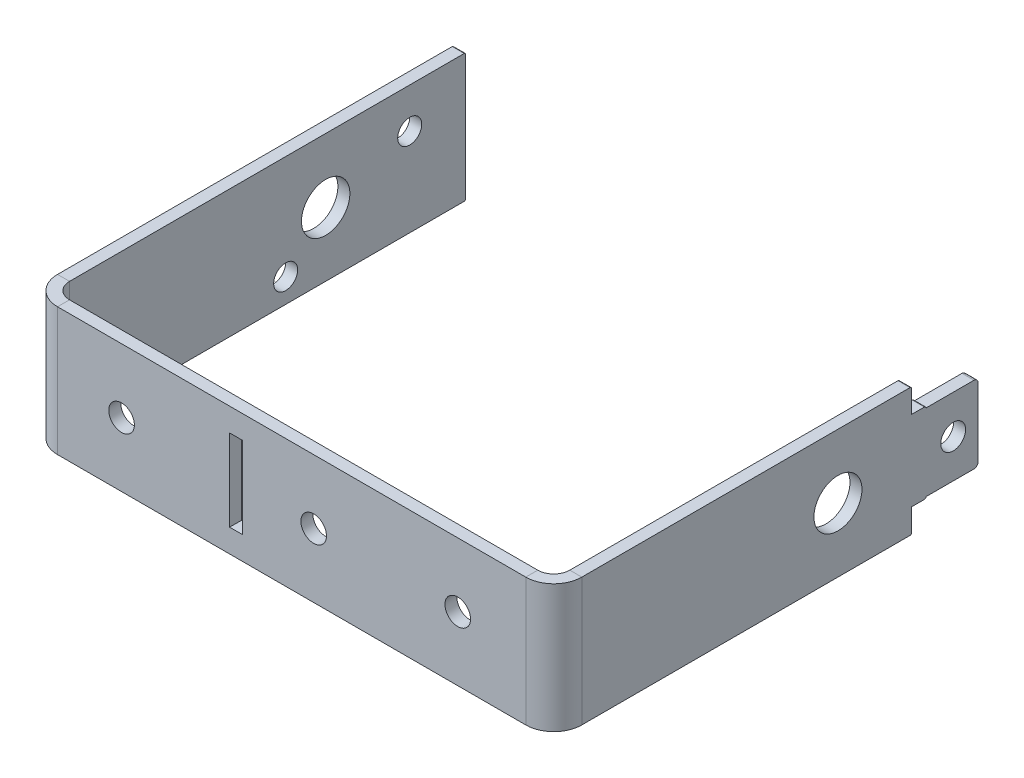
from build123d import *

# Parameters (mm, degrees)
BASE_FLANGE1_DEPTH = 16
SKETCH6_W          = 1.6
SKETCH6_H          = 10.2
CUT_EXTRUDE1_DEPTH = 10
SKETCH7_R          = 3
CUT_EXTRUDE2_DEPTH = 10
CUT_EXTRUDE3_DEPTH = 10
FILLET1_R          = 0.2
SKETCH11_R         = 1.55
TAB1_DEPTH         = 1.5
SKETCH15_R         = 1.6
CUT_EXTRUDE6_DEPTH = 10
SKETCH9_R          = 3.025
SKETCH9_R_2        = 1.5
CUT_EXTRUDE4_DEPTH = 10


# Sheet-metal steps are written as plain solids
with BuildPart() as part:
    # Sketch1 → Base-Flange1 (new body)
    with BuildSketch(Plane(origin=(0, 0, 0), x_dir=(1, 0, 0), z_dir=(0, 1, 0))):
        with BuildLine():
            Line((65.5, 50), (65.5, 3.5))
            ThreePointArc((65.5, 3.5), (64.474873734, 1.025126266), (62, 0))
            Line((62, 0), (3.5, 0))
            ThreePointArc((3.5, 0), (1.025126266, 1.025126266), (0, 3.5))
            Line((0, 3.5), (0, 53))
            Line((0, 53), (1.5, 53))
            Line((1.5, 53), (1.5, 3.5))
            ThreePointArc((1.5, 3.5), (2.085786438, 2.085786438), (3.5, 1.5))
            Line((3.5, 1.5), (62, 1.5))
            ThreePointArc((62, 1.5), (63.414213562, 2.085786438), (64, 3.5))
            Line((64, 3.5), (64, 50))
            Line((64, 50), (65.5, 50))
        make_face()
    extrude(amount=BASE_FLANGE1_DEPTH)

    # Sketch6 → Cut-Extrude1 (cut)
    with BuildSketch(Plane(origin=(0, 0, -1.5), x_dir=(-1, 0, 0), z_dir=(0, 0, -1))):
        with Locations((-25.8, 8)):
            Rectangle(SKETCH6_W, SKETCH6_H)
    extrude(amount=-CUT_EXTRUDE1_DEPTH, mode=Mode.SUBTRACT)

    # Sketch7 → Cut-Extrude2 (cut)
    with BuildSketch(Plane(origin=(65.5, 0, 0), x_dir=(0, 0, -1), z_dir=(1, 0, 0))):
        with Locations((35.5, 8)):
            Circle(SKETCH7_R)
    extrude(amount=-CUT_EXTRUDE2_DEPTH, mode=Mode.SUBTRACT)

    # Sketch8 → Cut-Extrude3 (cut)
    with BuildSketch(Plane(origin=(65.5, 0, 0), x_dir=(0, 0, -1), z_dir=(1, 0, 0))):
        Polygon((50, 16), (44.7, 16), (44.7, 13), (46.5, 13), (46.5, 3), (44.7, 3), (44.7, 0), (50, 0), (53, 0), (53, 16), align=None)
    extrude(amount=-CUT_EXTRUDE3_DEPTH, mode=Mode.SUBTRACT)

    # Fillet1
    fillet1_edges = [part.edges().sort_by_distance(p)[0] for p in [
        (0.75, 0, -53),
        (0.75, 16, -53),
        (64.75, 16, -44.7),
        (64.75, 0, -44.7),
        (64.75, 3, -46.5),
        (64.75, 13, -46.5),
    ]]
    fillet(fillet1_edges, radius=FILLET1_R)

    # Sketch11 → Tab1 (add)
    with BuildSketch(Plane(origin=(65.5, 0, 0), x_dir=(0, 0, -1), z_dir=(1, 0, 0))):
        with BuildLine():
            Line((46.5, 12.8), (52.5, 12.8))
            ThreePointArc((52.5, 12.8), (52.853553391, 12.653553391), (53, 12.3))
            Line((53, 12.3), (53, 3.7))
            ThreePointArc((53, 3.7), (52.853553391, 3.346446609), (52.5, 3.2))
            Line((52.5, 3.2), (46.5, 3.2))
            Line((46.5, 3.2), (46.5, 12.8))
        make_face()
        with Locations((49.9, 8)):
            Circle(SKETCH11_R, mode=Mode.SUBTRACT)
    extrude(amount=-TAB1_DEPTH)

    # Sketch15 → Cut-Extrude6 (cut)
    with BuildSketch(Plane.XY):
        with Locations((35.5, 8)):
            Circle(SKETCH15_R)
        with Locations((53.5, 8)):
            Circle(SKETCH15_R)
        with Locations((11.5, 8)):
            Circle(SKETCH15_R)
    extrude(amount=-CUT_EXTRUDE6_DEPTH, mode=Mode.SUBTRACT)

    # Sketch9 → Cut-Extrude4 (cut)
    with BuildSketch(Plane(origin=(1.5, 0, 0), x_dir=(0, 0, -1), z_dir=(1, 0, 0))):
        with Locations((35.5, 8)):
            Circle(SKETCH9_R)
        with Locations((30.5, 3)):
            Circle(SKETCH9_R_2)
        with Locations((46, 11)):
            Circle(SKETCH9_R_2)
    extrude(amount=-CUT_EXTRUDE4_DEPTH, mode=Mode.SUBTRACT)


solid = part.part
